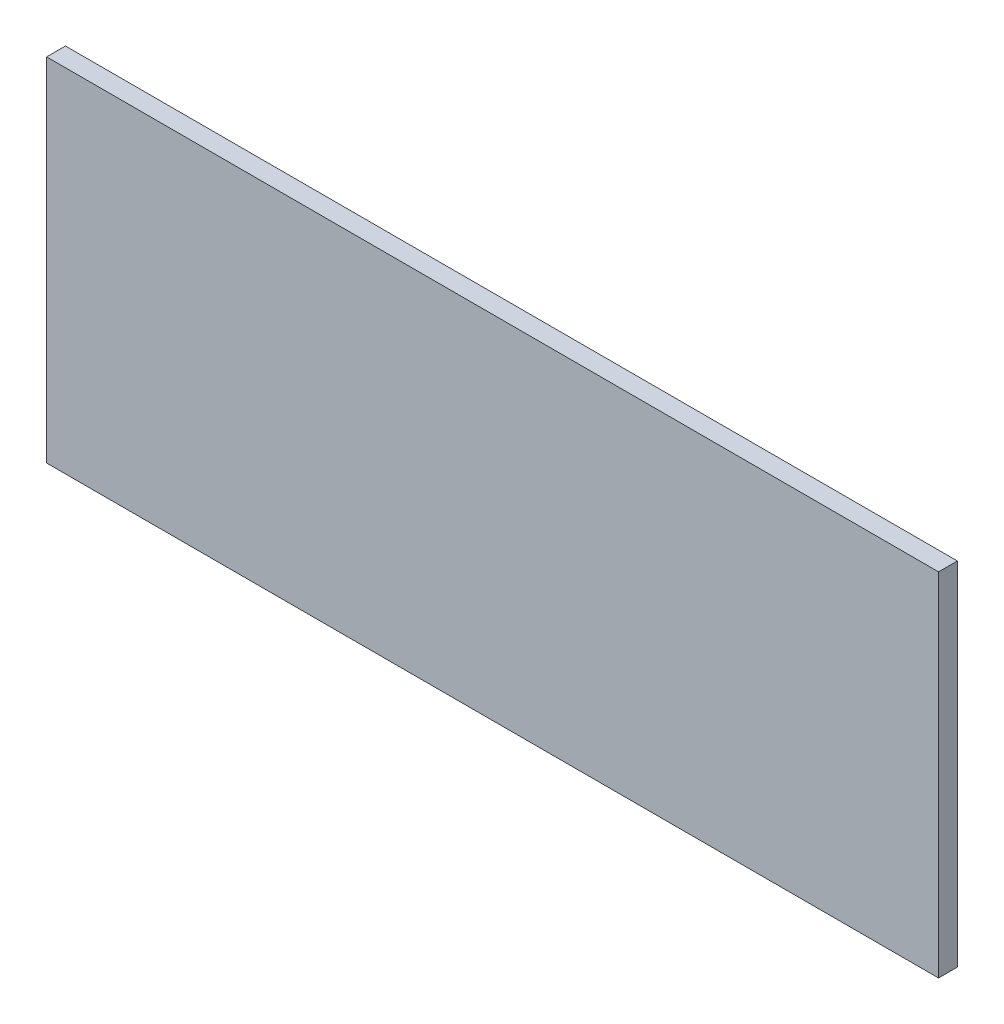
from build123d import *

# Parameters (mm, degrees)
SKETCH2_W           = 142
SKETCH2_H           = 56
BOSS_EXTRUDE1_DEPTH = 3


with BuildPart() as part:
    # Sketch2 → Boss-Extrude1 (new body)
    with BuildSketch(Plane.XY):
        with Locations((15, 0)):
            Rectangle(SKETCH2_W, SKETCH2_H)
    extrude(amount=BOSS_EXTRUDE1_DEPTH)


solid = part.part
